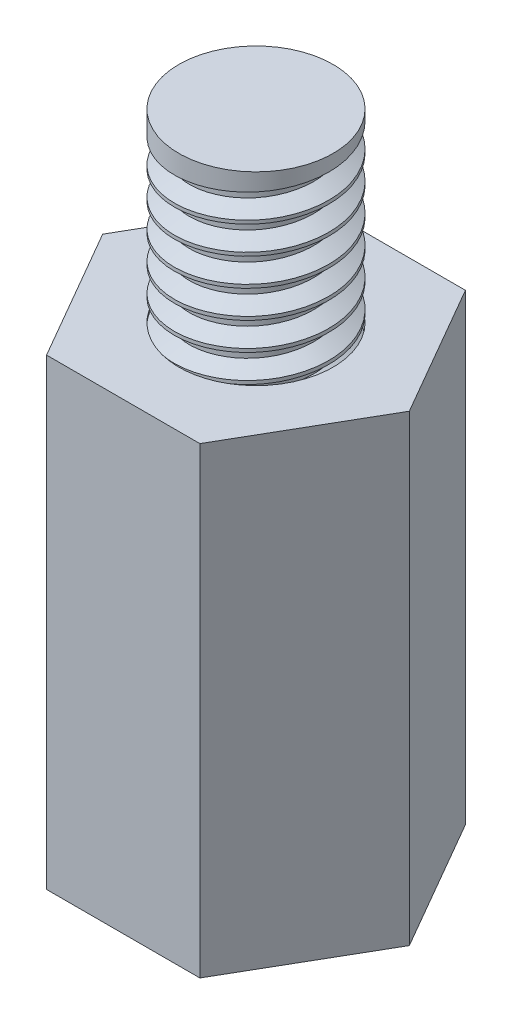
from build123d import *

# Parameters (mm, degrees)
SKETCH1_R                = 1.25
BOSS_EXTRUDE1_DEPTH      = 7.5
SKETCH1_3_R              = 1.25
CUT_EXTRUDE1_DEPTH       = 5
BOSS_EXTRUDE2_DEPTH      = 3
BOSS_EXTRUDE2_DEPTH_BACK = 1
SKETCH2_R                = 1.25
THREAD1_PITCH            = 0.45
THREAD2_PITCH            = 0.45


with BuildPart() as part:
    # Sketch1 → Boss-Extrude1 (new body)
    # profile 1 of 2: a face of its own
    with BuildSketch(Plane(origin=(0, 0, 0), x_dir=(1, 0, 0), z_dir=(0, 1, 0))):
        Polygon((-1.242294703, -2.151717543), (1.242294703, -2.151717543), (2.484589406, 0), (1.242294703, 2.151717543), (-1.242294703, 2.151717543), (-2.484589406, 0), align=None)
        Circle(SKETCH1_R, mode=Mode.SUBTRACT)
    # profile 2 of 2: a face of its own
    with BuildSketch(Plane(origin=(0, 0, 0), x_dir=(1, 0, 0), z_dir=(0, 1, 0))):
        Circle(SKETCH1_R)
    extrude(amount=BOSS_EXTRUDE1_DEPTH)

    # Sketch1<3> → Cut-Extrude1 (cut)
    with BuildSketch(Plane(origin=(0, 0, 0), x_dir=(1, 0, 0), z_dir=(0, 1, 0))):
        with Locations(Location((0, 0, 0), (0, 0, 270))):
            Circle(SKETCH1_3_R)
    extrude(amount=CUT_EXTRUDE1_DEPTH, mode=Mode.SUBTRACT)

    # Sketch2 → Boss-Extrude2 (add, two sides: drawn at the far end of the back side and taken through both)
    with BuildSketch(Plane(origin=(0, 7.5, 0), x_dir=(1, 0, 0), z_dir=(0, 1, 0)).offset(-BOSS_EXTRUDE2_DEPTH_BACK)):
        with Locations(Location((0, 0, 0), (0, 0, 270))):
            Circle(SKETCH2_R)
    extrude(amount=BOSS_EXTRUDE2_DEPTH + BOSS_EXTRUDE2_DEPTH_BACK)

    # Thread1: the profile of Thread Profile1 profile screwed along a right-hand helix of 6.666667 turns, 6 arcs to a turn; built about Z, then put on its axis
    thread1_z = Axis((0, 0, 0), (0, 0, 1))
    thread1_corners = [(1.2503, 0, -0.000173205), (1.2503, 0, 0.393923204), (1.006430356, 0, 0.253124999), (1.006430356, 0, 0.140624999)]
    with BuildLine(mode=Mode.PRIVATE) as thread1_profile:
        Line(thread1_corners[0], thread1_corners[1])
        Line(thread1_corners[1], thread1_corners[2])
        Line(thread1_corners[2], thread1_corners[3])
        Line(thread1_corners[3], thread1_corners[0])
    thread1_cap = Face(thread1_profile.wire())
    thread1_turn_angles = [0, 30, 60, 90, 120, 150, 180, 210, 240, 270, 300, 330, 360]
    thread1_turn_weights = [1, 0.8660254037844387, 1, 0.8660254037844387, 1, 0.8660254037844387, 1, 0.8660254037844387, 1, 0.8660254037844387, 1, 0.8660254037844387, 1]
    thread1_turn_rails = [Edge.make_bspline([Vector(p[0], p[1], 0).rotate(thread1_z, thread1_turn_angles[k]) / thread1_turn_weights[k] + Vector(0, 0, p[2] + THREAD1_PITCH * thread1_turn_angles[k] / 360) for k in range(13)], [0, 0, 0, 1, 1, 2, 2, 3, 3, 4, 4, 5, 5, 6, 6, 6], 2, thread1_turn_weights) for p in thread1_corners]
    thread1_turn_sides = [Face.make_surface_from_curves(thread1_turn_rails[p[0]], thread1_turn_rails[p[1]]) for p in [(0, 1), (1, 2), (2, 3), (3, 0)]]
    thread1_last_angles = [2160, 2190, 2220, 2250, 2280, 2310, 2340, 2370, 2400]
    thread1_last_weights = [1, 0.8660254037844387, 1, 0.8660254037844387, 1, 0.8660254037844387, 1, 0.8660254037844406, 1]
    thread1_last_rails = [Edge.make_bspline([Vector(p[0], p[1], 0).rotate(thread1_z, thread1_last_angles[k]) / thread1_last_weights[k] + Vector(0, 0, p[2] + THREAD1_PITCH * thread1_last_angles[k] / 360) for k in range(9)], [0, 0, 0, 1, 1, 2, 2, 3, 3, 4, 4, 4], 2, thread1_last_weights) for p in thread1_corners]
    thread1_last_sides = [Face.make_surface_from_curves(thread1_last_rails[p[0]], thread1_last_rails[p[1]]) for p in [(0, 1), (1, 2), (2, 3), (3, 0)]]
    thread1 = Plane(origin=(0, 10.5, 0), x_dir=(-1, 0, 0), z_dir=(0, -1, 0)) * Solid(Shell([*[p.moved(Location((0, 0, THREAD1_PITCH * i))) for i in range(6) for p in thread1_turn_sides], *thread1_last_sides, thread1_cap, thread1_cap.rotate(thread1_z, 2400).moved(Location((0, 0, THREAD1_PITCH * 2400 / 360)))]))
    add(thread1, mode=Mode.SUBTRACT)

    # Thread2: the profile of Thread Profile2 profile screwed along a right-hand helix of 4.444444 turns, 6 arcs to a turn; built about Z, then put on its axis
    thread2_z = Axis((0, 0, 0), (0, 0, 1))
    thread2_corners = [(1.2503, 0, -0.000173205), (1.2503, 0, 0.393923204), (1.006430356, 0, 0.253124999), (1.006430356, 0, 0.140624999)]
    with BuildLine(mode=Mode.PRIVATE) as thread2_profile:
        Line(thread2_corners[0], thread2_corners[1])
        Line(thread2_corners[1], thread2_corners[2])
        Line(thread2_corners[2], thread2_corners[3])
        Line(thread2_corners[3], thread2_corners[0])
    thread2_cap = Face(thread2_profile.wire())
    thread2_turn_angles = [0, 30, 60, 90, 120, 150, 180, 210, 240, 270, 300, 330, 360]
    thread2_turn_weights = [1, 0.8660254037844387, 1, 0.8660254037844387, 1, 0.8660254037844387, 1, 0.8660254037844387, 1, 0.8660254037844387, 1, 0.8660254037844387, 1]
    thread2_turn_rails = [Edge.make_bspline([Vector(p[0], p[1], 0).rotate(thread2_z, thread2_turn_angles[k]) / thread2_turn_weights[k] + Vector(0, 0, p[2] + THREAD2_PITCH * thread2_turn_angles[k] / 360) for k in range(13)], [0, 0, 0, 1, 1, 2, 2, 3, 3, 4, 4, 5, 5, 6, 6, 6], 2, thread2_turn_weights) for p in thread2_corners]
    thread2_turn_sides = [Face.make_surface_from_curves(thread2_turn_rails[p[0]], thread2_turn_rails[p[1]]) for p in [(0, 1), (1, 2), (2, 3), (3, 0)]]
    thread2_last_angles = [1440, 1470, 1500, 1530, 1560, 1580, 1600]
    thread2_last_weights = [1, 0.8660254037844387, 1, 0.8660254037844387, 1, 0.9396926207859078, 1]
    thread2_last_rails = [Edge.make_bspline([Vector(p[0], p[1], 0).rotate(thread2_z, thread2_last_angles[k]) / thread2_last_weights[k] + Vector(0, 0, p[2] + THREAD2_PITCH * thread2_last_angles[k] / 360) for k in range(7)], [0, 0, 0, 1, 1, 2, 2, 3, 3, 3], 2, thread2_last_weights) for p in thread2_corners]
    thread2_last_sides = [Face.make_surface_from_curves(thread2_last_rails[p[0]], thread2_last_rails[p[1]]) for p in [(0, 1), (1, 2), (2, 3), (3, 0)]]
    thread2 = Plane(origin=(0, 0, 0), x_dir=(1, 0, 0), z_dir=(0, 1, 0)) * Solid(Shell([*[p.moved(Location((0, 0, THREAD2_PITCH * i))) for i in range(4) for p in thread2_turn_sides], *thread2_last_sides, thread2_cap, thread2_cap.rotate(thread2_z, 1600).moved(Location((0, 0, THREAD2_PITCH * 1600 / 360)))]))
    add(thread2)


solid = part.part
